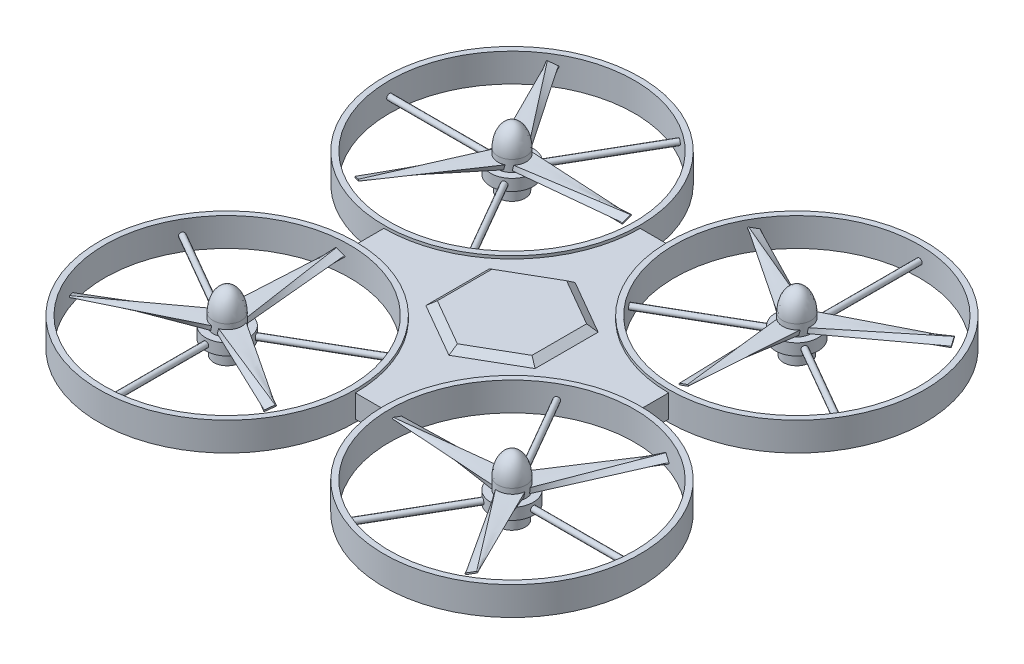
from build123d import *

# Parameters (mm, degrees)
BOSS_EXTRUDE2_DEPTH      = 4
SURFACE_EXTRUDE1_1_BACK  = 5
SURFACE_EXTRUDE1_1_DEPTH = 10
THICKEN1_T1              = 2
SKETCH4_R                = 7.5
BOSS_EXTRUDE3_DEPTH      = 2
SWEEP1_PROFILE_R         = 1
CIRPATTERN2_COUNT        = 3
SKETCH25_R               = 5
BOSS_EXTRUDE4_DEPTH      = 4
CIRPATTERN3_COUNT        = 3
DOME1_FACE_RADIUS        = 5
DOME1_HEIGHT             = 8
SKETCH47_R               = 4.656687964
BOSS_EXTRUDE5_DEPTH      = 5
CIRPATTERN6_COUNT        = 4


with BuildPart() as part:
    # Sketch1 → Boss-Extrude2 (new, symmetric)
    with BuildSketch(Plane(origin=(0, 0, 0), x_dir=(1, 0, 0), z_dir=(0, 1, 0))):
        with BuildLine():
            Line((-5, 50), (5, 50))
            ThreePointArc((5, 50), (18.180194847, 18.180194847), (50, 5))
            Line((50, 5), (50, -5))
            ThreePointArc((50, -5), (18.180194847, -18.180194847), (5, -50))
            Line((5, -50), (-5, -50))
            ThreePointArc((-5, -50), (-18.180194847, -18.180194847), (-50, -5))
            Line((-50, -5), (-50, 5))
            ThreePointArc((-50, 5), (-18.180194847, 18.180194847), (-5, 50))
        make_face()
    extrude(amount=BOSS_EXTRUDE2_DEPTH, both=True)

    # Surface-Extrude1: a surface, the sketch's curves swept straight by 10 mm
    with BuildLine(Plane(origin=(0, 0, 0), x_dir=(1, 0, 0), z_dir=(0, 1, 0)).offset(-SURFACE_EXTRUDE1_1_BACK), mode=Mode.PRIVATE) as surface_extrude1_1_path:
        CenterArc((50, 50), 45, 0, 360)
    surface_extrude1_1 = Shell.extrude(surface_extrude1_1_path.wire(), (0 * SURFACE_EXTRUDE1_1_DEPTH, 1 * SURFACE_EXTRUDE1_1_DEPTH, 0 * SURFACE_EXTRUDE1_1_DEPTH))
    add(Solid.thicken(surface_extrude1_1, THICKEN1_T1))



with BuildPart() as body_2:
    # Sketch4 → Boss-Extrude3 (new, symmetric)
    with BuildSketch(Plane(origin=(0, 0, 0), x_dir=(1, 0, 0), z_dir=(0, 1, 0))):
        with Locations(Location((50, 50, 0), (0, 0, 270))):
            Circle(SKETCH4_R)
    extrude(amount=BOSS_EXTRUDE3_DEPTH, both=True)


with BuildPart() as part_1:
    add(part.part)

    add(body_2.part)  # Sweep1 merges body 2
    # Sweep1: sweep along a path in Sketch6
    with BuildLine(Plane(origin=(0, 0, 0), x_dir=(1, 0, 0), z_dir=(0, 1, 0))) as sweep1_path:
        Line((50, 57.5), (50, 93))
    # Sweep1 profile (on start of the path) → Sweep1 (sweep)
    with BuildSketch(Plane(origin=(50, 0, -57.5), x_dir=(-1, 0, 0), z_dir=(0, 0, -1))):
        Circle(SWEEP1_PROFILE_R)
    sweep1 = sweep(path=sweep1_path.line)

    # CirPattern2: Sweep1 ×3 about axis
    cirpattern2_axis = Axis((50, 0, -50), (0, 1, 0))
    for i in range(1, CIRPATTERN2_COUNT):
        add(sweep1.rotate(cirpattern2_axis, i * 360 / CIRPATTERN2_COUNT))

    # Sketch25 → Boss-Extrude4 (add)
    with BuildSketch(Plane(origin=(0, 2, 0), x_dir=(1, 0, 0), z_dir=(0, 1, 0))):
        with Locations(Location((50, 50, 0), (0, 0, 270))):
            Circle(SKETCH25_R)
    extrude(amount=BOSS_EXTRUDE4_DEPTH)

    # Loft1: read off the stored shape, not the designer's step
    # Loft1: loft between two sections, ruled curve by curve
    loft1_from = [
        Edge.make_bspline([(51.624823889, 4.859489575, -10), (51.663977748, 4.873740414, -10), (51.719081043, 4.883154596, -10), (51.814777662, 4.85413465, -10), (51.848200289, 4.836767638, -10), (51.906552506, 4.784360588, -10), (51.93100124, 4.749225315, -10), (51.959502919, 4.670917597, -10), (51.96335862, 4.628287073, -10), (51.952344831, 4.550632861, -10), (51.937904913, 4.515845307, -10), (51.883250712, 4.432102138, -10), (51.834987819, 4.403894104, -10), (51.79583396, 4.389643265, -10)], [0, 0, 0, 0, 0.25, 0.25, 0.375, 0.375, 0.5, 0.5, 0.625, 0.625, 0.75, 0.75, 1, 1, 1, 1], 3),
        Edge.make_bspline([(51.79583396, 4.389643265, -10), (51.32598765, 4.218633193, -10), (50.856141339, 4.047623121, -10), (49.916448719, 3.705602978, -10), (49.446602408, 3.534592906, -10), (48.976756098, 3.363582835, -10)], [0, 0, 0, 0, 0.5, 0.5, 1, 1, 1, 1], 3),
        Edge.make_bspline([(48.805746026, 3.833429145, -10), (49.275592337, 4.004439217, -10), (49.745438647, 4.175449288, -10), (50.685131268, 4.517469432, -10), (51.154977578, 4.688479503, -10), (51.624823889, 4.859489575, -10)], [0, 0, 0, 0, 0.5, 0.5, 1, 1, 1, 1], 3),
        Edge.make_bspline([(48.976756098, 3.363582835, -10), (48.937602239, 3.349331995, -10), (48.882498943, 3.339917814, -10), (48.786802325, 3.36893776, -10), (48.753379698, 3.386304772, -10), (48.69502748, 3.438711822, -10), (48.670578746, 3.473847095, -10), (48.642077068, 3.552154813, -10), (48.638221367, 3.594785337, -10), (48.649235156, 3.672439549, -10), (48.663675073, 3.707227103, -10), (48.718329274, 3.790970272, -10), (48.766592167, 3.819178306, -10), (48.805746026, 3.833429145, -10)], [0, 0, 0, 0, 0.25, 0.25, 0.375, 0.375, 0.5, 0.5, 0.625, 0.625, 0.75, 0.75, 1, 1, 1, 1], 3),
    ]
    loft1_to = [
        Edge.make_bspline([(46.275210507, 4.136089689, -50), (46.941877174, 4.136089689, -50), (47.608543841, 4.136089689, -50), (48.608543841, 4.136089689, -50), (48.941877174, 4.136089689, -50), (49.608543841, 4.136089689, -50), (49.941877174, 4.136089689, -50), (50.608543841, 4.136089689, -50), (50.941877174, 4.136089689, -50), (51.608543841, 4.136089689, -50), (51.941877174, 4.136089689, -50), (52.941877174, 4.136089689, -50), (53.608543841, 4.136089689, -50), (54.275210507, 4.136089689, -50)], [0, 0, 0, 0, 0.25, 0.25, 0.375, 0.375, 0.5, 0.5, 0.625, 0.625, 0.75, 0.75, 1, 1, 1, 1], 3),
        Edge.make_bspline([(54.275210507, 4.136089689, -50), (54.275210507, 3.854246871, -50), (54.275210507, 3.572404053, -50), (54.275210507, 3.008718416, -50), (54.275210507, 2.726875597, -50), (54.275210507, 2.445032779, -50)], [0, 0, 0, 0, 0.5, 0.5, 1, 1, 1, 1], 3),
        Edge.make_bspline([(46.275210507, 2.445032779, -50), (46.275210507, 2.726875597, -50), (46.275210507, 3.008718416, -50), (46.275210507, 3.572404053, -50), (46.275210507, 3.854246871, -50), (46.275210507, 4.136089689, -50)], [0, 0, 0, 0, 0.5, 0.5, 1, 1, 1, 1], 3),
        Edge.make_bspline([(54.275210507, 2.445032779, -50), (53.608543841, 2.445032779, -50), (52.941877174, 2.445032779, -50), (51.941877174, 2.445032779, -50), (51.608543841, 2.445032779, -50), (50.941877174, 2.445032779, -50), (50.608543841, 2.445032779, -50), (49.941877174, 2.445032779, -50), (49.608543841, 2.445032779, -50), (48.941877174, 2.445032779, -50), (48.608543841, 2.445032779, -50), (47.608543841, 2.445032779, -50), (46.941877174, 2.445032779, -50), (46.275210507, 2.445032779, -50)], [0, 0, 0, 0, 0.25, 0.25, 0.375, 0.375, 0.5, 0.5, 0.625, 0.625, 0.75, 0.75, 1, 1, 1, 1], 3),
    ]
    loft1 = Solid(Shell([*[Face.make_surface_from_curves(loft1_from[k], loft1_to[k]) for k in range(4)], Face(Wire(loft1_from)), Face(Wire(loft1_to))]))
    add(loft1)

    # CirPattern3: Loft1 ×3 about axis
    cirpattern3_axis = Axis((50, 6, -50), (0, 1, 0))
    for i in range(1, CIRPATTERN3_COUNT):
        add(loft1.rotate(cirpattern3_axis, i * 360 / CIRPATTERN3_COUNT))

    # Dome1: an elliptical dome of height H over a round flat face of radius A is half a spheroid: the quarter ellipse of half axes A and H revolved about the face's axis
    with BuildSketch(Plane((50, 6, -50), x_dir=(0, 0, -1), z_dir=(1, 0, 0)), mode=Mode.PRIVATE) as dome1_quarter:
        Ellipse(DOME1_FACE_RADIUS, DOME1_HEIGHT)
        Rectangle(DOME1_FACE_RADIUS, DOME1_HEIGHT, align=(Align.MIN, Align.MIN), mode=Mode.INTERSECT)
    revolve(dome1_quarter.sketch, axis=Axis((50, 6, -50), (0, 1, 0)))

    # Sketch47 → Boss-Extrude5 (add)
    with BuildSketch(Plane.XZ.offset(2)):
        with Locations(Location((50, -50, 0), (0, 0, 270))):
            Circle(SKETCH47_R)
    extrude(amount=BOSS_EXTRUDE5_DEPTH)


with BuildPart() as cirpattern6_1:
    # CirPattern6: pattern copy
    add(part_1.part.rotate(Axis((0, 15.05, 0), (0, -1, 0)), 1 * 360 / CIRPATTERN6_COUNT))


with BuildPart() as cirpattern6_2:
    # CirPattern6: pattern copy
    add(part_1.part.rotate(Axis((0, 15.05, 0), (0, -1, 0)), 2 * 360 / CIRPATTERN6_COUNT))


with BuildPart() as cirpattern6_3:
    # CirPattern6: pattern copy
    add(part_1.part.rotate(Axis((0, 15.05, 0), (0, -1, 0)), 3 * 360 / CIRPATTERN6_COUNT))


with BuildPart() as part_2:
    add(part_1.part)

    add(cirpattern6_1.part)  # Loft2 merges CirPattern6_1

    add(cirpattern6_2.part)  # Loft2 merges CirPattern6_2

    add(cirpattern6_3.part)  # Loft2 merges CirPattern6_3
    # Sketch49 → Loft2 section 0
    with BuildSketch(Plane(origin=(0, 6, 0), x_dir=(1, 0, 0), z_dir=(0, 1, 0))):
        with BuildLine():
            Line((0, 19.172935887), (-16.604249543, 9.586467943))
            Line((-16.604249543, 9.586467943), (-16.604249543, -9.586467943))
            Line((-16.604249543, -9.586467943), (0, -19.172935887))
            Line((0, -19.172935887), (16.604249543, -9.586467943))
            Line((16.604249543, -9.586467943), (16.604249543, 9.586467943))
            Line((16.604249543, 9.586467943), (0, 19.172935887))
        make_face()
    # Sketch48 → Loft2 section 1
    with BuildSketch(Plane(origin=(0, 4, 0), x_dir=(1, 0, 0), z_dir=(0, 1, 0))):
        with BuildLine():
            Line((0, 22.138999391), (-19.172935887, 11.069499695))
            Line((-19.172935887, 11.069499695), (-19.172935887, -11.069499695))
            Line((-19.172935887, -11.069499695), (0, -22.138999391))
            Line((0, -22.138999391), (19.172935887, -11.069499695))
            Line((19.172935887, -11.069499695), (19.172935887, 11.069499695))
            Line((19.172935887, 11.069499695), (0, 22.138999391))
        make_face()
    loft()


solid = part_2.part
